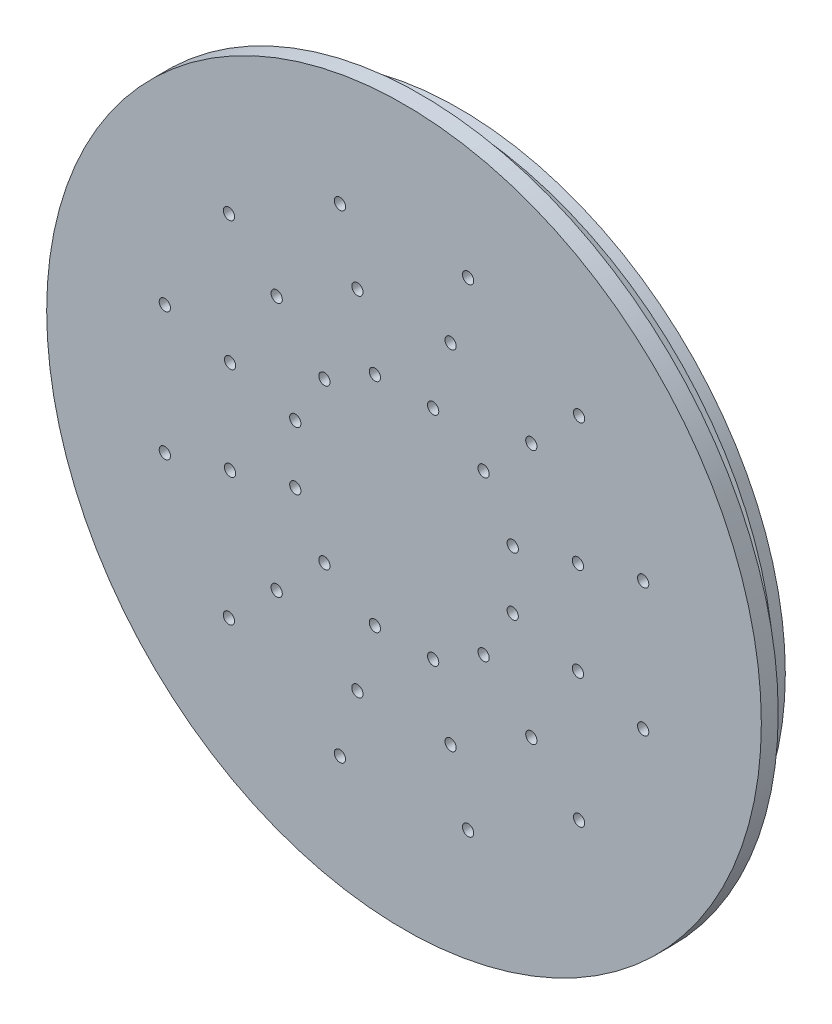
from build123d import *
from build123d.topology import SkipClean

# Parameters (mm, degrees)
CUT_EXTRUDE1_START = 5
SKETCH1_3_R        = 2.38125
CUT_EXTRUDE1_DEPTH = 86.331646759
CUT_EXTRUDE2_REACH = 96.345
CUT_EXTRUDE2_START = -4.38125
SKETCH2_R          = 1
SKETCH2_R_2        = 0.5
CIRPATTERN2_COUNT  = 12


with BuildPart() as part:
    # Sketch1 → Revolve1 (revolve)
    with BuildSketch(Plane.YZ):
        Polygon((0, 0), (58, 0), (58, 2), (53, 2), (53, 6.7625), (63.5, 6.7625), (63.5, 9.7625), (0, 9.7625), align=None)
    revolve(axis=Axis((0, 0, 9.7625), (0, 0, -1)))

    # Sketch1<3> → Cut-Extrude1 (cut, through all)
    with SkipClean():  # the faces are left unmerged after this step: merging them gives an invalid solid
        with BuildSketch(Plane.YZ.offset(CUT_EXTRUDE1_START)):
            with Locations((0, 4.38125)):
                Circle(SKETCH1_3_R)
        cut_extrude1 = extrude(amount=CUT_EXTRUDE1_DEPTH, mode=Mode.SUBTRACT)

    # Sketch2 → Cut-Extrude2 (cut, up to next)
    with BuildSketch(Plane(origin=(0, 0, 4.38125), x_dir=(0, 1, 0), z_dir=(0, 0, 1)).offset(CUT_EXTRUDE2_START), mode=Mode.PRIVATE) as cut_extrude2_sk1:
        with Locations((11.388037985, -42.500736357)):
            Circle(SKETCH2_R)
    cut_extrude2_tool1 = extrude(cut_extrude2_sk1.sketch, amount=CUT_EXTRUDE2_REACH, mode=Mode.PRIVATE) & part.part
    # Sketch2 → Cut-Extrude2 (cut, up to next)
    with BuildSketch(Plane(origin=(0, 0, 4.38125), x_dir=(0, 1, 0), z_dir=(0, 0, 1)).offset(CUT_EXTRUDE2_START), mode=Mode.PRIVATE) as cut_extrude2_sk2:
        with Locations((8.282209443, -30.909626441)):
            Circle(SKETCH2_R)
    cut_extrude2_tool2 = extrude(cut_extrude2_sk2.sketch, amount=CUT_EXTRUDE2_REACH, mode=Mode.PRIVATE) & part.part
    # Sketch2 → Cut-Extrude2 (cut, up to next)
    with BuildSketch(Plane(origin=(0, 0, 4.38125), x_dir=(0, 1, 0), z_dir=(0, 0, 1)).offset(CUT_EXTRUDE2_START), mode=Mode.PRIVATE) as cut_extrude2_sk3:
        with Locations((0, -54)):
            Circle(SKETCH2_R_2)
    cut_extrude2_tool3 = extrude(cut_extrude2_sk3.sketch, amount=CUT_EXTRUDE2_REACH, mode=Mode.PRIVATE) & part.part
    # Sketch2 → Cut-Extrude2 (cut, up to next)
    with BuildSketch(Plane(origin=(0, 0, 4.38125), x_dir=(0, 1, 0), z_dir=(0, 0, 1)).offset(CUT_EXTRUDE2_START), mode=Mode.PRIVATE) as cut_extrude2_sk4:
        with Locations((13.976228436, -52.15999462)):
            Circle(SKETCH2_R_2)
    cut_extrude2_tool4 = extrude(cut_extrude2_sk4.sketch, amount=CUT_EXTRUDE2_REACH, mode=Mode.PRIVATE) & part.part
    # Sketch2 → Cut-Extrude2 (cut, up to next)
    with BuildSketch(Plane(origin=(0, 0, 4.38125), x_dir=(0, 1, 0), z_dir=(0, 0, 1)).offset(CUT_EXTRUDE2_START), mode=Mode.PRIVATE) as cut_extrude2_sk5:
        with Locations((7.04841438, -53.538022514)):
            Circle(SKETCH2_R_2)
    cut_extrude2_tool5 = extrude(cut_extrude2_sk5.sketch, amount=CUT_EXTRUDE2_REACH, mode=Mode.PRIVATE) & part.part
    # Sketch2 → Cut-Extrude2 (cut, up to next)
    with BuildSketch(Plane(origin=(0, 0, 4.38125), x_dir=(0, 1, 0), z_dir=(0, 0, 1)).offset(CUT_EXTRUDE2_START), mode=Mode.PRIVATE) as cut_extrude2_sk6:
        with Locations((20.664905348, -49.889494756)):
            Circle(SKETCH2_R_2)
    cut_extrude2_tool6 = extrude(cut_extrude2_sk6.sketch, amount=CUT_EXTRUDE2_REACH, mode=Mode.PRIVATE) & part.part
    # Sketch2 → Cut-Extrude2 (cut, up to next)
    with BuildSketch(Plane(origin=(0, 0, 4.38125), x_dir=(0, 1, 0), z_dir=(0, 0, 1)).offset(CUT_EXTRUDE2_START), mode=Mode.PRIVATE) as cut_extrude2_sk7:
        with Locations((5.176380902, -19.318516526)):
            Circle(SKETCH2_R)
    cut_extrude2_tool7 = extrude(cut_extrude2_sk7.sketch, amount=CUT_EXTRUDE2_REACH, mode=Mode.PRIVATE) & part.part
    cut_extrude2_1 = cut_extrude2_tool1.solids().sort_by_distance((42.500736, 11.388038, 0))[0]
    add(cut_extrude2_1, mode=Mode.SUBTRACT)
    cut_extrude2_2 = cut_extrude2_tool2.solids().sort_by_distance((30.909626, 8.282209, 0))[0]
    add(cut_extrude2_2, mode=Mode.SUBTRACT)
    cut_extrude2_3 = cut_extrude2_tool3.solids().sort_by_distance((54, 0, 0))[0]
    add(cut_extrude2_3, mode=Mode.SUBTRACT)
    cut_extrude2_4 = cut_extrude2_tool4.solids().sort_by_distance((52.159995, 13.976228, 0))[0]
    add(cut_extrude2_4, mode=Mode.SUBTRACT)
    cut_extrude2_5 = cut_extrude2_tool5.solids().sort_by_distance((53.538023, 7.048414, 0))[0]
    add(cut_extrude2_5, mode=Mode.SUBTRACT)
    cut_extrude2_6 = cut_extrude2_tool6.solids().sort_by_distance((49.889495, 20.664905, 0))[0]
    add(cut_extrude2_6, mode=Mode.SUBTRACT)
    cut_extrude2_7 = cut_extrude2_tool7.solids().sort_by_distance((19.318517, 5.176381, 0))[0]
    add(cut_extrude2_7, mode=Mode.SUBTRACT)
    cut_extrude2 = cut_extrude2_1 + cut_extrude2_2 + cut_extrude2_3 + cut_extrude2_4 + cut_extrude2_5 + cut_extrude2_6 + cut_extrude2_7  # Cut-Extrude2 as one shape, for the pattern or mirror that repeats it

    # Sketch4 → Cut-Revolve1 (revolve, cut)
    with SkipClean():  # the faces are left unmerged after this step: merging them gives an invalid solid
        with BuildSketch(Plane(origin=(42.500736357, 11.388037985, 0), x_dir=(-0.2588190451025214, 0.9659258262890682, 0), z_dir=(0.9659258262890682, 0.2588190451025214, 0))):
            Polygon((-11.319918157, 4.552260072), (-11.789764467, 4.38125), (-0.266044443, -27.279910554), (0, -26.548959454), align=None)
        cut_revolve1 = revolve(axis=Axis((45.552151938, 0, 4.38125), (-0.08852132690137607, 0.3303660895493484, -0.9396926207859098)), mode=Mode.SUBTRACT)

    # Sketch4<3> → Cut-Revolve2 (revolve, cut)
    with SkipClean():  # the faces are left unmerged after this step: merging them gives an invalid solid
        with BuildSketch(Plane(origin=(42.500736357, 11.388037985, 0), x_dir=(-0.2588190451025214, 0.9659258262890682, 0), z_dir=(0.9659258262890682, 0.2588190451025214, 0))):
            Polygon((11.319918157, 4.552260072), (0, -26.548959454), (0.266044443, -27.279910554), (11.789764467, 4.38125), align=None)
        cut_revolve2 = revolve(axis=Axis((42.500736357, 11.388037985, -28.010861654), (-0.08852132690137626, 0.3303660895493491, 0.9396926207859096)), mode=Mode.SUBTRACT)

    # Sketch5 → Cut-Revolve3 (revolve, cut)
    with SkipClean():  # the faces are left unmerged after this step: merging them gives an invalid solid
        with BuildSketch(Plane(origin=(30.909626441, 8.282209443, 0), x_dir=(-0.2588190451025214, 0.9659258262890681, 0), z_dir=(0.9659258262890682, 0.2588190451025214, 0))):
            Polygon((-8.104527847, 4.552260072), (-8.574374158, 4.38125), (-0.266044443, -18.445698284), (0, -17.714747184), align=None)
        cut_revolve3 = revolve(axis=Axis((33.128837773, 0, 4.38125), (-0.08852132690137789, 0.3303660895493549, -0.9396926207859073)), mode=Mode.SUBTRACT)

    # Sketch5<3> → Cut-Revolve4 (revolve, cut)
    with SkipClean():  # the faces are left unmerged after this step: merging them gives an invalid solid
        with BuildSketch(Plane(origin=(30.909626441, 8.282209443, 0), x_dir=(-0.2588190451025214, 0.9659258262890681, 0), z_dir=(0.9659258262890682, 0.2588190451025214, 0))):
            Polygon((8.574374158, 4.38125), (0, -19.176649384), (-0.46984631, -19.005639313), (8.104527847, 4.552260072), align=None)
        cut_revolve4 = revolve(axis=Axis((28.690415109, 16.564418887, 4.38125), (0.08852132690137812, -0.3303660895493559, -0.939692620785907)), mode=Mode.SUBTRACT)

    # Sketch6 → Cut-Revolve5 (revolve, cut)
    with SkipClean():  # the faces are left unmerged after this step: merging them gives an invalid solid
        with BuildSketch(Plane(origin=(19.318516526, 5.176380902, 0), x_dir=(-0.25881904510252146, 0.9659258262890681, 0), z_dir=(0.9659258262890681, 0.25881904510252146, 0))):
            Polygon((-4.889137538, 4.552260072), (-5.358983849, 4.38125), (-0.266044443, -9.611486015), (0, -8.880534915), align=None)
        cut_revolve5 = revolve(axis=Axis((20.705523608, 0, 4.38125), (-0.08852132690137596, 0.33036608954934793, -0.93969262078591)), mode=Mode.SUBTRACT)

    # Sketch6<4> → Cut-Revolve6 (revolve, cut)
    with SkipClean():  # the faces are left unmerged after this step: merging them gives an invalid solid
        with BuildSketch(Plane(origin=(19.318516526, 5.176380902, 0), x_dir=(-0.25881904510252146, 0.9659258262890681, 0), z_dir=(0.9659258262890681, 0.25881904510252146, 0))):
            Polygon((4.889137538, 4.552260072), (0, -8.880534915), (0.266044443, -9.611486015), (5.358983849, 4.38125), align=None)
        cut_revolve6 = revolve(axis=Axis((19.318516526, 5.176380902, -10.342437115), (-0.08852132690137637, 0.3303660895493491, 0.9396926207859096)), mode=Mode.SUBTRACT)

    # CirPattern2: Cut-Extrude1, Cut-Extrude2, Cut-Revolve1, Cut-Revolve2, Cut-Revolve3, Cut-Revolve4, Cut-Revolve5, Cut-Revolve6 ×12 about axis
    cirpattern2_axis = Axis((0, 0, 9.7625), (0, 0, 1))
    add([cut_extrude1.rotate(cirpattern2_axis, i * 360 / CIRPATTERN2_COUNT) for i in range(1, CIRPATTERN2_COUNT)], mode=Mode.SUBTRACT)
    add([cut_extrude2.rotate(cirpattern2_axis, i * 360 / CIRPATTERN2_COUNT) for i in range(1, CIRPATTERN2_COUNT)], mode=Mode.SUBTRACT)
    add([cut_revolve1.rotate(cirpattern2_axis, i * 360 / CIRPATTERN2_COUNT) for i in range(1, CIRPATTERN2_COUNT)], mode=Mode.SUBTRACT)
    add([cut_revolve2.rotate(cirpattern2_axis, i * 360 / CIRPATTERN2_COUNT) for i in range(1, CIRPATTERN2_COUNT)], mode=Mode.SUBTRACT)
    add([cut_revolve3.rotate(cirpattern2_axis, i * 360 / CIRPATTERN2_COUNT) for i in range(1, CIRPATTERN2_COUNT)], mode=Mode.SUBTRACT)
    add([cut_revolve4.rotate(cirpattern2_axis, i * 360 / CIRPATTERN2_COUNT) for i in range(1, CIRPATTERN2_COUNT)], mode=Mode.SUBTRACT)
    add([cut_revolve5.rotate(cirpattern2_axis, i * 360 / CIRPATTERN2_COUNT) for i in range(1, CIRPATTERN2_COUNT)], mode=Mode.SUBTRACT)
    add([cut_revolve6.rotate(cirpattern2_axis, i * 360 / CIRPATTERN2_COUNT) for i in range(1, CIRPATTERN2_COUNT)], mode=Mode.SUBTRACT)


solid = part.part
